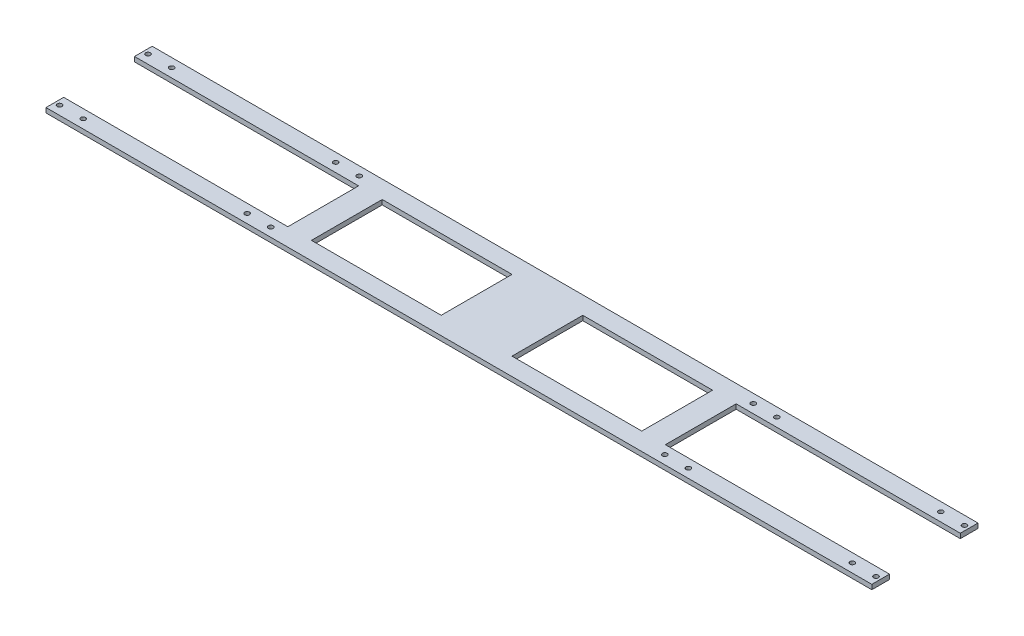
from build123d import *

# Parameters (mm, degrees)
SKETCH_1_W                                 = 700
SKETCH_1_H                                 = 90
SKETCH_1_W_2                               = 280
SKETCH_1_H_2                               = 60
EXTRUDE_1_DEPTH                            = 4
SKETCH_2_W                                 = 190
SKETCH_2_H                                 = 60
CUT_EXTRUDE_1_DEPTH                        = 4
SKETCH_4_R                                 = 2
CUT_EXTRUDE_2_DEPTH                        = 15
MIRROR_2_AT_THE_SECOND_PLANE_COPY_1_SKET_R = 2
MIRROR_2_AT_THE_SECOND_PLANE_COPY_1_DEPTH  = 15
SKETCH_5_W                                 = 60
SKETCH_5_H                                 = 60
EXTRUDE_2_DEPTH                            = 4


with BuildPart() as part:
    # 草图1 → 凸台-拉伸1 (new body)
    with BuildSketch(Plane(origin=(0, 0, 0), x_dir=(1, 0, 0), z_dir=(0, 1, 0))):
        Rectangle(SKETCH_1_W, SKETCH_1_H)
        Rectangle(SKETCH_1_W_2, SKETCH_1_H_2, mode=Mode.SUBTRACT)
    extrude(amount=EXTRUDE_1_DEPTH)

    # 草图2 → 切除-拉伸1 (cut)
    with BuildSketch(Plane(origin=(0, 4, 0), x_dir=(1, 0, 0), z_dir=(0, 1, 0))):
        with Locations((-255, 0)):
            Rectangle(SKETCH_2_W, SKETCH_2_H)
    cut_extrude_1 = extrude(amount=-CUT_EXTRUDE_1_DEPTH, mode=Mode.SUBTRACT)

    # 镜向1: 切除-拉伸1 across plane
    add(cut_extrude_1.mirror(Plane(origin=(0, 0, 0), x_dir=(0, 0, 1), z_dir=(1, 0, 0))), mode=Mode.SUBTRACT)

    # 草图4 → 切除-拉伸2 (cut)
    with BuildSketch(Plane(origin=(0, 4, 0), x_dir=(1, 0, 0), z_dir=(0, 1, 0))):
        with Locations((-187, 37.5)):
            Circle(SKETCH_4_R)
        with Locations((-167, 37.5)):
            Circle(SKETCH_4_R)
        with Locations((-346, 37.5)):
            Circle(SKETCH_4_R)
        with Locations((-326, 37.5)):
            Circle(SKETCH_4_R)
    cut_extrude_2 = extrude(amount=-CUT_EXTRUDE_2_DEPTH, mode=Mode.SUBTRACT)

    # 镜向2: 切除-拉伸2 across plane
    add(cut_extrude_2.mirror(Plane(origin=(0, 0, 0), x_dir=(0, 0, 1), z_dir=(1, 0, 0))), mode=Mode.SUBTRACT)

    # 镜向2 at the second plane: 切除-拉伸2 across plane
    add(cut_extrude_2.mirror(Plane.XY), mode=Mode.SUBTRACT)

    # 镜向2 at the second plane copy 1 sket → 镜向2 at the second plane copy 1 (cut)
    with BuildSketch(Plane(origin=(0, 4, 0), x_dir=(-1, 0, 0), z_dir=(0, 1, 0))):
        with Locations((-187, 37.5)):
            Circle(MIRROR_2_AT_THE_SECOND_PLANE_COPY_1_SKET_R)
        with Locations((-167, 37.5)):
            Circle(MIRROR_2_AT_THE_SECOND_PLANE_COPY_1_SKET_R)
        with Locations((-346, 37.5)):
            Circle(MIRROR_2_AT_THE_SECOND_PLANE_COPY_1_SKET_R)
        with Locations((-326, 37.5)):
            Circle(MIRROR_2_AT_THE_SECOND_PLANE_COPY_1_SKET_R)
    extrude(amount=-MIRROR_2_AT_THE_SECOND_PLANE_COPY_1_DEPTH, mode=Mode.SUBTRACT)

    # 草图5 → 凸台-拉伸2 (add)
    with BuildSketch(Plane(origin=(0, 4, 0), x_dir=(1, 0, 0), z_dir=(0, 1, 0))):
        Rectangle(SKETCH_5_W, SKETCH_5_H)
    extrude(amount=-EXTRUDE_2_DEPTH)


solid = part.part
